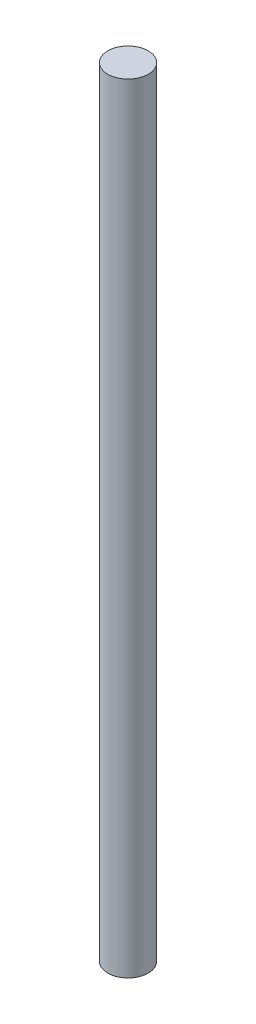
from build123d import *

# Parameters (mm, degrees)
SKETCH1_R           = 7.9375
BOSS_EXTRUDE1_DEPTH = 152.4


with BuildPart() as part:
    # Sketch1 → Boss-Extrude1 (new, symmetric)
    with BuildSketch(Plane(origin=(0, 0, 0), x_dir=(1, 0, 0), z_dir=(0, 1, 0))):
        Circle(SKETCH1_R)
    extrude(amount=BOSS_EXTRUDE1_DEPTH, both=True)


solid = part.part
